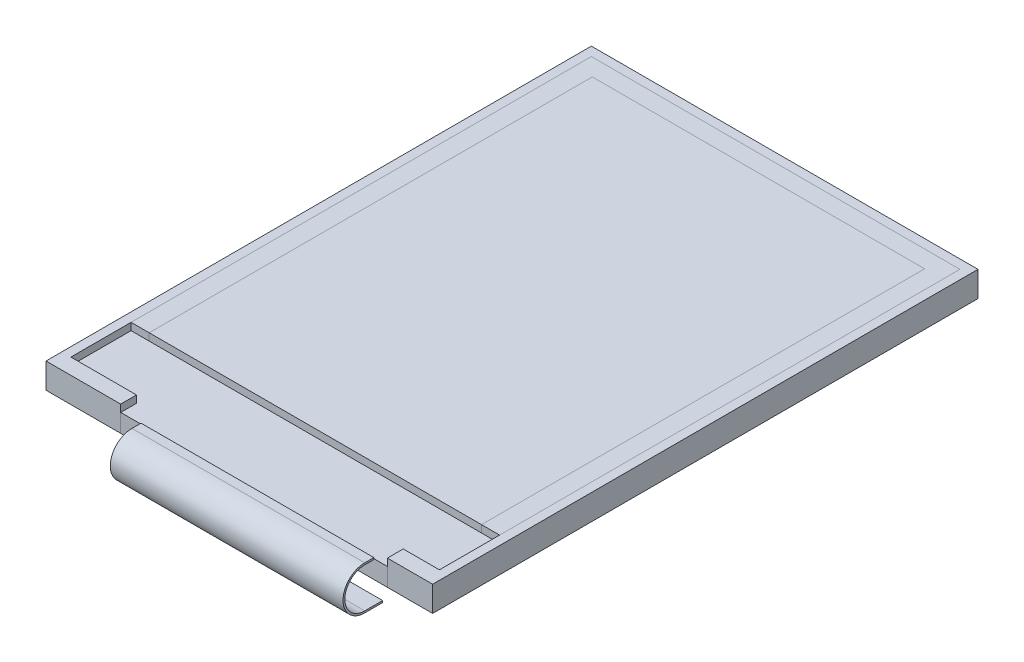
from build123d import *

# Parameters (mm, degrees)
SKETCH2_W                = 42.72
SKETCH2_H                = 60.26
BOSS_EXTRUDE1_DEPTH      = 2
SKETCH3_W                = 36.72
SKETCH3_H                = 48.96
BOSS_EXTRUDE2_DEPTH      = 0.8
BOSS_EXTRUDE3_DEPTH      = 0.8
BOSS_EXTRUDE4_DEPTH      = 0.8
BOSS_EXTRUDE4_DEPTH_BACK = 2
CUT_EXTRUDE1_DEPTH       = 42.886157916
SKETCH13_W               = 12.6
SKETCH13_H               = 5
BOSS_EXTRUDE6_DEPTH      = 0.15
THICKEN4_START           = -6.36
THICKEN4_DEPTH           = 12.6
THICKEN4_START_2         = -10.86
THICKEN4_2_DEPTH         = 25.72


# Read off the part's stored shape, not the designer's step: Thicken4
with BuildPart() as part:
    # Sketch2 → Boss-Extrude1 (new body)
    with BuildSketch(Plane(origin=(0, 4.6, 0), x_dir=(1, 0, 0), z_dir=(0, 1, 0))):
        with Locations((0, -5.845)):
            Rectangle(SKETCH2_W, SKETCH2_H)
    extrude(amount=-BOSS_EXTRUDE1_DEPTH)

    # Sketch5<2> → Cut-Extrude1 (cut, through all)
    with BuildSketch(Plane(origin=(0, 4.6, 0), x_dir=(1, 0, 0), z_dir=(0, 1, 0))):
        Polygon((-20.36, 23.285), (20.36, 23.285), (20.36, -34.225), (16.36, -34.225), (16.36, -35.975), (21.36, -35.975), (21.36, 24.285), (-21.36, 24.285), (-21.36, -35.975), (-13.11, -35.975), (-13.11, -34.225), (-20.36, -34.225), align=None)
    extrude(amount=-CUT_EXTRUDE1_DEPTH, mode=Mode.SUBTRACT)


with BuildPart() as body_2:
    # Sketch3 → Boss-Extrude2 (new body)
    with BuildSketch(Plane(origin=(0, 4.6, 0), x_dir=(1, 0, 0), z_dir=(0, 1, 0))):
        with Locations((0, -3.095)):
            Rectangle(SKETCH3_W, SKETCH3_H)
    extrude(amount=BOSS_EXTRUDE2_DEPTH)


with BuildPart() as body_3:
    # Sketch4 → Boss-Extrude3 (new body)
    with BuildSketch(Plane(origin=(0, 4.6, 0), x_dir=(1, 0, 0), z_dir=(0, 1, 0))):
        Polygon((-18.36, -27.575), (-20.36, -27.575), (-20.36, 23.285), (20.36, 23.285), (20.36, -27.575), (18.36, -27.575), (18.36, 21.385), (-18.36, 21.385), align=None)
    extrude(amount=BOSS_EXTRUDE3_DEPTH)


with BuildPart() as body_4:
    # Sketch5 → Boss-Extrude4 (new, two sides: drawn at the far end of the back side and taken through both)
    with BuildSketch(Plane(origin=(0, 4.6, 0), x_dir=(1, 0, 0), z_dir=(0, 1, 0)).offset(-BOSS_EXTRUDE4_DEPTH_BACK)):
        Polygon((-20.36, 23.285), (20.36, 23.285), (20.36, -34.225), (16.36, -34.225), (16.36, -35.975), (21.36, -35.975), (21.36, 24.285), (-21.36, 24.285), (-21.36, -35.975), (-13.11, -35.975), (-13.11, -34.225), (-20.36, -34.225), align=None)
    extrude(amount=BOSS_EXTRUDE4_DEPTH + BOSS_EXTRUDE4_DEPTH_BACK)


with BuildPart() as body_5:
    # Sketch13 → Boss-Extrude6 (new, symmetric)
    with BuildSketch(Plane(origin=(0, 0, 0), x_dir=(1, 0, 0), z_dir=(0, 1, 0))):
        with Locations((-0.06, -2.5)):
            Rectangle(SKETCH13_W, SKETCH13_H)
    extrude(amount=BOSS_EXTRUDE6_DEPTH, both=True)


with BuildPart() as body_6:
    # Thicken4 outline → Thicken4 (new body)
    with BuildSketch(Plane.YZ.offset(THICKEN4_START)):
        with BuildLine():
            Line((0.1, 0), (0.1, 36.975))
            ThreePointArc((0.1, 36.975), (2.3, 39.175), (4.5, 36.975))
            Line((4.5, 36.975), (4.5, 35.975))
            Line((4.5, 35.975), (4.7, 35.975))
            Line((4.7, 35.975), (4.7, 36.975))
            ThreePointArc((4.7, 36.975), (2.3, 39.375), (-0.1, 36.975))
            Line((-0.1, 36.975), (-0.1, 0))
            Line((-0.1, 0), (0.1, 0))
        make_face()
    extrude(amount=THICKEN4_DEPTH)

    # Thicken4 2 outline → Thicken4 2 (add)
    with BuildSketch(Plane.YZ.offset(THICKEN4_START_2)):
        with BuildLine():
            Line((-0.1, 35), (0.1, 35))
            Line((0.1, 35), (0.1, 36.975))
            ThreePointArc((0.1, 36.975), (2.3, 39.175), (4.5, 36.975))
            Line((4.5, 36.975), (4.5, 35.975))
            Line((4.5, 35.975), (4.7, 35.975))
            Line((4.7, 35.975), (4.7, 36.975))
            ThreePointArc((4.7, 36.975), (2.3, 39.375), (-0.1, 36.975))
            Line((-0.1, 36.975), (-0.1, 35))
        make_face()
    extrude(amount=THICKEN4_2_DEPTH)


solid = Compound([part.part, body_2.part, body_3.part, body_4.part, body_5.part, body_6.part])
